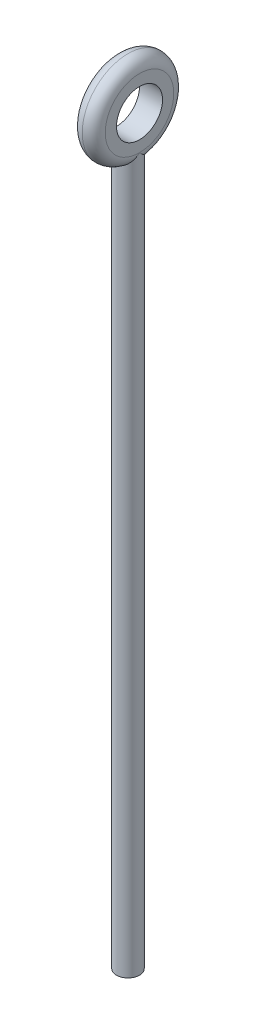
from build123d import *

# Parameters (mm, degrees)
SKETCH1_R                = 12.626048476
SKETCH1_R_2              = 6.35
BOSS_EXTRUDE1_DEPTH      = 6.35
BOSS_EXTRUDE2_DEPTH      = 6.35
SKETCH4_R                = 3.175
BOSS_EXTRUDE3_DEPTH      = 50.8
CUT_EXTRUDE1_START       = -6.35
CUT_EXTRUDE1_DEPTH       = 6.35
SKETCH7_R                = 3.175
BOSS_EXTRUDE4_DEPTH      = 57.15
SKETCH7_2_R              = 3.175
CUT_EXTRUDE2_DEPTH       = 25.4
FILLET1_R                = 3.175
BOSS_EXTRUDE5_DEPTH      = 139.7
BOSS_EXTRUDE5_DEPTH_BACK = 25.4
SKETCH7_3_R              = 3.175


with BuildPart() as part:
    # Sketch1 → Boss-Extrude1 (new body)
    with BuildSketch(Plane(origin=(0, 0, 0), x_dir=(0, 0, -1), z_dir=(1, 0, 0))):
        Circle(SKETCH1_R)
        Circle(SKETCH1_R_2, mode=Mode.SUBTRACT)
    extrude(amount=BOSS_EXTRUDE1_DEPTH)

    # Sketch3 → Boss-Extrude2 (add)
    with BuildSketch(Plane(origin=(6.35, 0, 0), x_dir=(0, 0, -1), z_dir=(1, 0, 0))):
        Polygon((-8.994798287, -8.860626609), (-8.994798287, -15.452306957), (10.798615768, -15.452306957), (10.798615768, -6.542705681), (-8.994798287, -6.542705681), align=None)
    extrude(amount=-BOSS_EXTRUDE2_DEPTH)

    # Sketch4 → Boss-Extrude3 (add)
    with BuildSketch(Plane.XZ.offset(15.452306957)):
        with Locations(Location((3.175, 0, 0), (0, 0, 180))):
            Circle(SKETCH4_R)
    extrude(amount=BOSS_EXTRUDE3_DEPTH)

    # Sketch5 → Cut-Extrude1 (cut)
    with BuildSketch(Plane(origin=(6.35, 0, 0), x_dir=(0, 0, -1), z_dir=(1, 0, 0)).offset(CUT_EXTRUDE1_START)):
        with BuildLine():
            Line((-8.994798287, -8.860626609), (-8.994798287, -15.452306957))
            Line((-8.994798287, -15.452306957), (10.798615768, -15.452306957))
            Line((10.798615768, -15.452306957), (10.798615768, -6.542705681))
            ThreePointArc((10.798615768, -6.542705681), (1.46854647, -12.540353719), (-8.994798287, -8.860626609))
        make_face()
    extrude(amount=CUT_EXTRUDE1_DEPTH, mode=Mode.SUBTRACT)


with BuildPart() as cut_extrude1_piece_1:
    # of the separate pieces the step leaves, piece 1, a body of its own (cut_extrude1_pieces)
    add(part.part.solids().sort_by_distance((0, -6.542705681, -10.798615768))[0])



with BuildPart() as cut_extrude1_piece_2:
    # of the separate pieces the step leaves, piece 2, a body of its own (cut_extrude1_pieces)
    add(part.part.solids().sort_by_distance((0, -15.452306957, 0))[0])


with BuildPart() as cut_extrude1_piece_1_1:
    add(cut_extrude1_piece_1.part)

    add(cut_extrude1_piece_2.part)  # Boss-Extrude4 merges Cut-Extrude1 piece 2
    # Sketch7 → Boss-Extrude4 (add)
    with BuildSketch(Plane.XZ.offset(66.252306957)):
        with Locations((3.175, 0)):
            Circle(SKETCH7_R)
    extrude(amount=-BOSS_EXTRUDE4_DEPTH)

    # Sketch7<2> → Cut-Extrude2 (cut)
    with BuildSketch(Plane.XZ.offset(66.252306957)):
        with Locations((3.175, 0)):
            Circle(SKETCH7_2_R)
    extrude(amount=-CUT_EXTRUDE2_DEPTH, mode=Mode.SUBTRACT)

    # Fillet1
    # the kernel refuses this fillet: 3.175 mm, written as the material it takes off along each edge
    with BuildSketch(Plane(origin=(6.35, 0, 0), x_dir=(0, -0.7017735299957855, 0.7124001071008161), z_dir=(0, -0.7124001071008161, -0.7017735299957855))) as fillet1_piece_1:
        with BuildLine():
            CenterArc((12.626048476 - FILLET1_R, FILLET1_R), FILLET1_R, 270, 90)
            Line((12.626048476 - FILLET1_R, 0), (12.626048476, 0))
            Line((12.626048476, 0), (12.626048476, FILLET1_R))
        make_face()
    revolve(axis=Axis((6.35, 0, 0), (-1, 0, 0)), revolution_arc=255.78045899, mode=Mode.SUBTRACT)
    with BuildSketch(Plane(origin=(0, 0, 0), x_dir=(0, -0.5181910787843432, -0.855264874684047), z_dir=(0, -0.855264874684047, 0.5181910787843432))) as fillet1_piece_2:
        with BuildLine():
            CenterArc((12.626048476 - FILLET1_R, FILLET1_R), FILLET1_R, 270, 90)
            Line((12.626048476 - FILLET1_R, 0), (12.626048476, 0))
            Line((12.626048476, 0), (12.626048476, FILLET1_R))
        make_face()
    revolve(axis=Axis((0, 0, 0), (1, 0, 0)), revolution_arc=255.78045899, mode=Mode.SUBTRACT)
    with BuildSketch(Plane(origin=(0, 0, 0), x_dir=(0, -0.5181910787843435, -0.8552648746840469), z_dir=(0, 0.8552648746840469, -0.5181910787843435))) as fillet1_piece_3_section:
        with BuildLine():
            CenterArc((12.626048476 - FILLET1_R, -FILLET1_R), FILLET1_R, 0, 90)
            Line((12.626048476 - FILLET1_R, 0), (12.626048476, 0))
            Line((12.626048476, 0), (12.626048476, -FILLET1_R))
        make_face()
    fillet1_piece_3 = revolve(axis=Axis((0, 0, 0), (-1, 0, 0)), revolution_arc=58.789009325, mode=Mode.PRIVATE)
    fillet1_piece_3 = fillet1_piece_3 - Plane(origin=(3.175, -9.611252213, 0), x_dir=(1, 0, 0), z_dir=(0, -1, 0)) * Cylinder(3.175, 51, mode=Mode.PRIVATE)
    add(fillet1_piece_3, mode=Mode.SUBTRACT)
    with BuildSketch(Plane(origin=(0, 0, 0), x_dir=(0, -1, 0), z_dir=(0, 0, -1))) as fillet1_piece_4_section:
        with BuildLine():
            CenterArc((12.626048476 - FILLET1_R, -FILLET1_R), FILLET1_R, 0, 90)
            Line((12.626048476 - FILLET1_R, 0), (12.626048476, 0))
            Line((12.626048476, 0), (12.626048476, -FILLET1_R))
        make_face()
    fillet1_piece_4 = revolve(axis=Axis((0, 0, 0), (-1, 0, 0)), revolution_arc=45.430531685, mode=Mode.PRIVATE)
    fillet1_piece_4 = fillet1_piece_4 - Plane(origin=(3.175, -10.439695548, 0), x_dir=(1, 0, 0), z_dir=(0, -1, 0)) * Cylinder(3.175, 51, mode=Mode.PRIVATE)
    add(fillet1_piece_4, mode=Mode.SUBTRACT)
    with BuildSketch(Plane(origin=(6.35, 0, 0), x_dir=(0, -1, 0), z_dir=(0, 0, -1))) as fillet1_piece_5_section:
        with BuildLine():
            CenterArc((12.626048476 - FILLET1_R, FILLET1_R), FILLET1_R, 270, 90)
            Line((12.626048476 - FILLET1_R, 0), (12.626048476, 0))
            Line((12.626048476, 0), (12.626048476, FILLET1_R))
        make_face()
    fillet1_piece_5 = revolve(axis=Axis((6.35, 0, 0), (-1, 0, 0)), revolution_arc=45.430531685, mode=Mode.PRIVATE)
    fillet1_piece_5 = fillet1_piece_5 - Plane(origin=(3.175, -10.439696502, 0), x_dir=(1, 0, 0), z_dir=(0, -1, 0)) * Cylinder(3.175, 51, mode=Mode.PRIVATE)
    add(fillet1_piece_5, mode=Mode.SUBTRACT)
    with BuildSketch(Plane(origin=(6.35, 0, 0), x_dir=(0, -0.5181910787843435, -0.8552648746840469), z_dir=(0, 0.8552648746840469, -0.5181910787843435))) as fillet1_piece_6_section:
        with BuildLine():
            CenterArc((12.626048476 - FILLET1_R, FILLET1_R), FILLET1_R, 270, 90)
            Line((12.626048476 - FILLET1_R, 0), (12.626048476, 0))
            Line((12.626048476, 0), (12.626048476, FILLET1_R))
        make_face()
    fillet1_piece_6 = revolve(axis=Axis((6.35, 0, 0), (-1, 0, 0)), revolution_arc=58.789009325, mode=Mode.PRIVATE)
    fillet1_piece_6 = fillet1_piece_6 - Plane(origin=(3.175, -9.611252422, 0), x_dir=(1, 0, 0), z_dir=(0, -1, 0)) * Cylinder(3.175, 51, mode=Mode.PRIVATE)
    add(fillet1_piece_6, mode=Mode.SUBTRACT)

    # Sketch7<3> → Boss-Extrude5 (add, two sides: drawn at the far end of the back side and taken through both)
    with BuildSketch(Plane.XZ.offset(66.252306957).offset(-BOSS_EXTRUDE5_DEPTH_BACK)):
        with Locations(Location((3.175, 0, 0), (0, 0, 270))):
            Circle(SKETCH7_3_R)
    extrude(amount=BOSS_EXTRUDE5_DEPTH + BOSS_EXTRUDE5_DEPTH_BACK)


solid = cut_extrude1_piece_1_1.part
